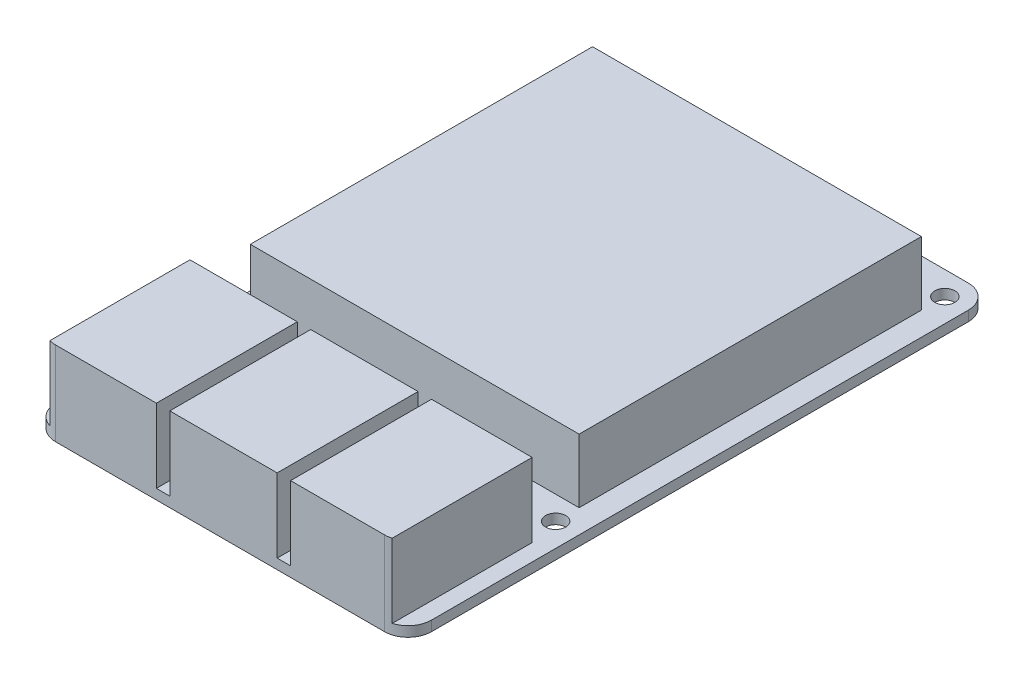
from build123d import *

# Parameters (mm, degrees)
SKETCH_1_R      = 1.5
EXTRUDE_1_DEPTH = 1.5
SKETCH_2_W      = 16
SKETCH_2_H      = 21
EXTRUDE_2_DEPTH = 11
SKETCH_3_W      = 49
SKETCH_3_H      = 51
EXTRUDE_3_DEPTH = 9.5


with BuildPart() as part:
    # Эскиз1 → Бобышка-Вытянуть1 (new body)
    with BuildSketch(Plane(origin=(0, 0, 0), x_dir=(1, 0, 0), z_dir=(0, 1, 0))):
        with BuildLine():
            Line((3.5, 0), (52.5, 0))
            ThreePointArc((52.5, 0), (54.974873734, 1.025126266), (56, 3.5))
            Line((56, 3.5), (56, 83.5))
            ThreePointArc((56, 83.5), (54.974873734, 85.974873734), (52.5, 87))
            Line((52.5, 87), (3.5, 87))
            ThreePointArc((3.5, 87), (1.025126266, 85.974873734), (0, 83.5))
            Line((0, 83.5), (0, 3.5))
            ThreePointArc((0, 3.5), (1.025126266, 1.025126266), (3.5, 0))
        make_face()
        with Locations((3.5, 83.5)):
            Circle(SKETCH_1_R, mode=Mode.SUBTRACT)
        with Locations((52.5, 83.5)):
            Circle(SKETCH_1_R, mode=Mode.SUBTRACT)
        with Locations((52.5, 25.5)):
            Circle(SKETCH_1_R, mode=Mode.SUBTRACT)
        with Locations((3.5, 25.5)):
            Circle(SKETCH_1_R, mode=Mode.SUBTRACT)
    extrude(amount=EXTRUDE_1_DEPTH)

    # Эскиз2 → Бобышка-Вытянуть2 (add)
    with BuildSketch(Plane(origin=(0, 1.5, 0), x_dir=(1, 0, 0), z_dir=(0, 1, 0))):
        with BuildLine():
            Line((3.5, 0), (18.5, 0))
            Line((18.5, 0), (18.5, 21))
            Line((18.5, 21), (2.5, 21))
            Line((2.5, 21), (2.5, 0.145898034))
            ThreePointArc((2.5, 0.145898034), (2.994706462, 0.036666571), (3.5, 0))
        make_face()
        with BuildLine():
            Line((38.5, 21), (38.5, 0))
            Line((38.5, 0), (52.5, 0))
            ThreePointArc((52.5, 0), (53.005293538, 0.036666571), (53.5, 0.145898034))
            Line((53.5, 0.145898034), (53.5, 21))
            Line((53.5, 21), (38.5, 21))
        make_face()
        with Locations((28.5, 10.5)):
            Rectangle(SKETCH_2_W, SKETCH_2_H)
    extrude(amount=EXTRUDE_2_DEPTH)

    # Эскиз3 → Бобышка-Вытянуть3 (add)
    with BuildSketch(Plane(origin=(0, 1.5, 0), x_dir=(1, 0, 0), z_dir=(0, 1, 0))):
        with Locations((28, 54.5)):
            Rectangle(SKETCH_3_W, SKETCH_3_H)
    extrude(amount=EXTRUDE_3_DEPTH)


solid = part.part
